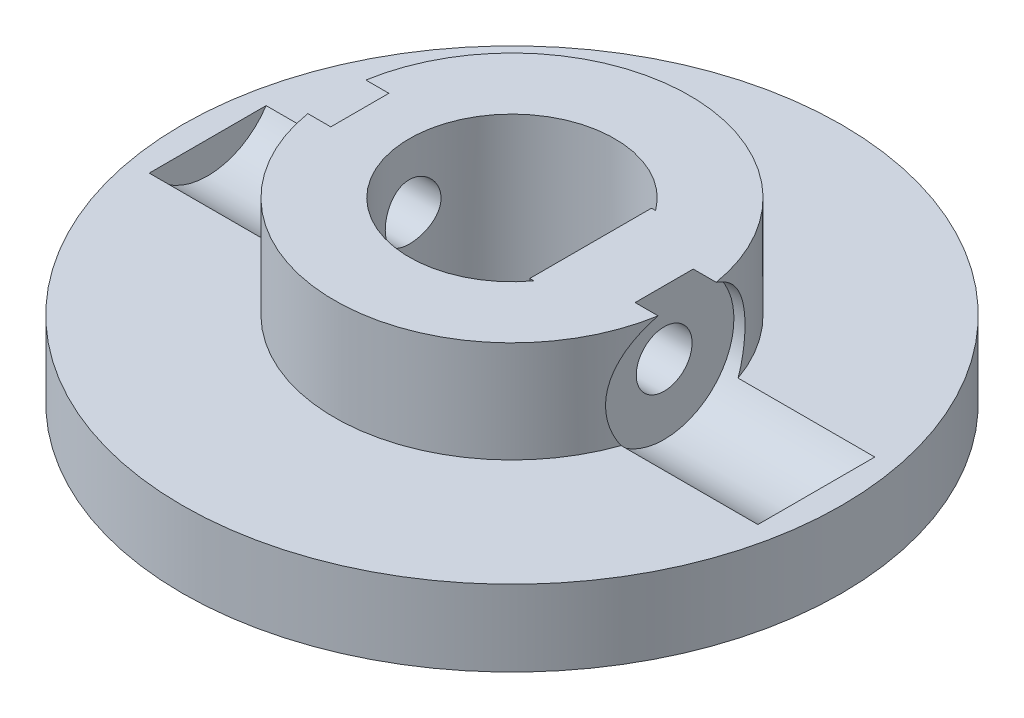
from build123d import *

# Parameters (mm, degrees)
STOCK_HORN_DRIVE_FLANGE_START                 = 41
STOCK_HORN_DRIVE_FLANGE_PROFILE_R             = 13
STOCK_HORN_DRIVE_FLANGE_PROFILE_R_2           = 4.05
STOCK_HORN_DRIVE_FLANGE_DEPTH                 = 3
D_COUPLING_RING_START                         = 44
D_COUPLING_RING_PROFILE_R                     = 7
D_COUPLING_RING_PROFILE_R_2                   = 4.05
D_COUPLING_RING_DEPTH                         = 4
D_KEY_LAND_START                              = 44
D_KEY_LAND_PROFILE_W                          = 2.9
D_KEY_LAND_PROFILE_H                          = 4.8
D_KEY_LAND_DEPTH                              = 4
YAW_POSITIVE_RETENTION_CROSSBOLT_START        = -10
YAW_POSITIVE_RETENTION_CROSSBOLT_PROFILE_R    = 1.1
YAW_POSITIVE_RETENTION_CROSSBOLT_DEPTH        = 62.400389104
CROSSBOLT_FLAT_SEAT_CUT_12_START              = -12
CROSSBOLT_FLAT_SEAT_12_R                      = 2.75
CROSSBOLT_FLAT_SEAT_CUT_12_DEPTH              = 6
CROSSBOLT_FLAT_SEAT_CUT_6_START               = 6
CROSSBOLT_FLAT_SEAT_6_R                       = 2.75
CROSSBOLT_FLAT_SEAT_CUT_6_DEPTH               = 6
SG90_SPLINE_SOCKET_BOSS_OD12_START            = 37.3
SG90_SPLINE_SOCKET_BOSS_PROFILE_R             = 6
SG90_SPLINE_SOCKET_BOSS_OD12_DEPTH            = 3.7
SG90_SPLINE_PRESS_SOCKET_D4P85_DEPTH2P5_START = 37.3
SG90_SPLINE_PRESS_SOCKET_D4P85_DEPTH_2_R      = 2.425
SG90_SPLINE_PRESS_SOCKET_D4P85_DEPTH2P5_DEPTH = 2.5
SG90_CENTRE_SCREW_CLEARANCE_D2P4_START        = 39.8
SG90_CENTRE_SCREW_CLEARANCE_D2P4_PROFILE_R    = 1.2
SG90_CENTRE_SCREW_CLEARANCE_D2P4_DEPTH        = 1.2


with BuildPart() as part:
    # Stock_horn_drive_flange_profile → Stock_horn_drive_flange (new body)
    with BuildSketch(Plane(origin=(0, 0, 0), x_dir=(1, 0, 0), z_dir=(0, 1, 0)).offset(STOCK_HORN_DRIVE_FLANGE_START)):
        Circle(STOCK_HORN_DRIVE_FLANGE_PROFILE_R)
        Circle(STOCK_HORN_DRIVE_FLANGE_PROFILE_R_2, mode=Mode.SUBTRACT)
    extrude(amount=STOCK_HORN_DRIVE_FLANGE_DEPTH)

    # D_coupling_ring_profile → D_coupling_ring (add)
    with BuildSketch(Plane(origin=(0, 0, 0), x_dir=(1, 0, 0), z_dir=(0, 1, 0)).offset(D_COUPLING_RING_START)):
        Circle(D_COUPLING_RING_PROFILE_R)
        Circle(D_COUPLING_RING_PROFILE_R_2, mode=Mode.SUBTRACT)
    extrude(amount=D_COUPLING_RING_DEPTH)

    # D_key_land_profile → D_key_land (add)
    with BuildSketch(Plane(origin=(0, 0, 0), x_dir=(1, 0, 0), z_dir=(0, 1, 0)).offset(D_KEY_LAND_START)):
        with Locations((4.55, 0)):
            Rectangle(D_KEY_LAND_PROFILE_W, D_KEY_LAND_PROFILE_H)
    extrude(amount=D_KEY_LAND_DEPTH)

    # Yaw_positive_retention_crossbolt_profile → Yaw_positive_retention_crossbolt (cut, through all)
    with BuildSketch(Plane(origin=(0, 0, 0), x_dir=(0, 0, -1), z_dir=(1, 0, 0)).offset(YAW_POSITIVE_RETENTION_CROSSBOLT_START)):
        with Locations((0, 45.5)):
            Circle(YAW_POSITIVE_RETENTION_CROSSBOLT_PROFILE_R)
    extrude(amount=YAW_POSITIVE_RETENTION_CROSSBOLT_DEPTH, mode=Mode.SUBTRACT)

    # Crossbolt_flat_seat_-12 → Crossbolt_flat_seat_cut_-12 (cut)
    with BuildSketch(Plane(origin=(0, 0, 0), x_dir=(0, 0, -1), z_dir=(1, 0, 0)).offset(CROSSBOLT_FLAT_SEAT_CUT_12_START)):
        with Locations((0, 45.5)):
            Circle(CROSSBOLT_FLAT_SEAT_12_R)
    extrude(amount=CROSSBOLT_FLAT_SEAT_CUT_12_DEPTH, mode=Mode.SUBTRACT)

    # Crossbolt_flat_seat_6 → Crossbolt_flat_seat_cut_6 (cut)
    with BuildSketch(Plane(origin=(0, 0, 0), x_dir=(0, 0, -1), z_dir=(1, 0, 0)).offset(CROSSBOLT_FLAT_SEAT_CUT_6_START)):
        with Locations((0, 45.5)):
            Circle(CROSSBOLT_FLAT_SEAT_6_R)
    extrude(amount=CROSSBOLT_FLAT_SEAT_CUT_6_DEPTH, mode=Mode.SUBTRACT)

    # SG90_spline_socket_boss_profile → SG90_spline_socket_boss_OD12 (add)
    with BuildSketch(Plane(origin=(0, 0, 0), x_dir=(1, 0, 0), z_dir=(0, 1, 0)).offset(SG90_SPLINE_SOCKET_BOSS_OD12_START)):
        Circle(SG90_SPLINE_SOCKET_BOSS_PROFILE_R)
    extrude(amount=SG90_SPLINE_SOCKET_BOSS_OD12_DEPTH)

    # SG90_spline_press_socket_D4p85_depth 2 → SG90_spline_press_socket_D4p85_depth2p5 (cut)
    with BuildSketch(Plane(origin=(0, 0, 0), x_dir=(1, 0, 0), z_dir=(0, 1, 0)).offset(SG90_SPLINE_PRESS_SOCKET_D4P85_DEPTH2P5_START)):
        Circle(SG90_SPLINE_PRESS_SOCKET_D4P85_DEPTH_2_R)
    extrude(amount=SG90_SPLINE_PRESS_SOCKET_D4P85_DEPTH2P5_DEPTH, mode=Mode.SUBTRACT)

    # SG90_centre_screw_clearance_D2p4_profile → SG90_centre_screw_clearance_D2p4 (cut)
    with BuildSketch(Plane(origin=(0, 0, 0), x_dir=(1, 0, 0), z_dir=(0, 1, 0)).offset(SG90_CENTRE_SCREW_CLEARANCE_D2P4_START)):
        Circle(SG90_CENTRE_SCREW_CLEARANCE_D2P4_PROFILE_R)
    extrude(amount=SG90_CENTRE_SCREW_CLEARANCE_D2P4_DEPTH, mode=Mode.SUBTRACT)


solid = part.part
